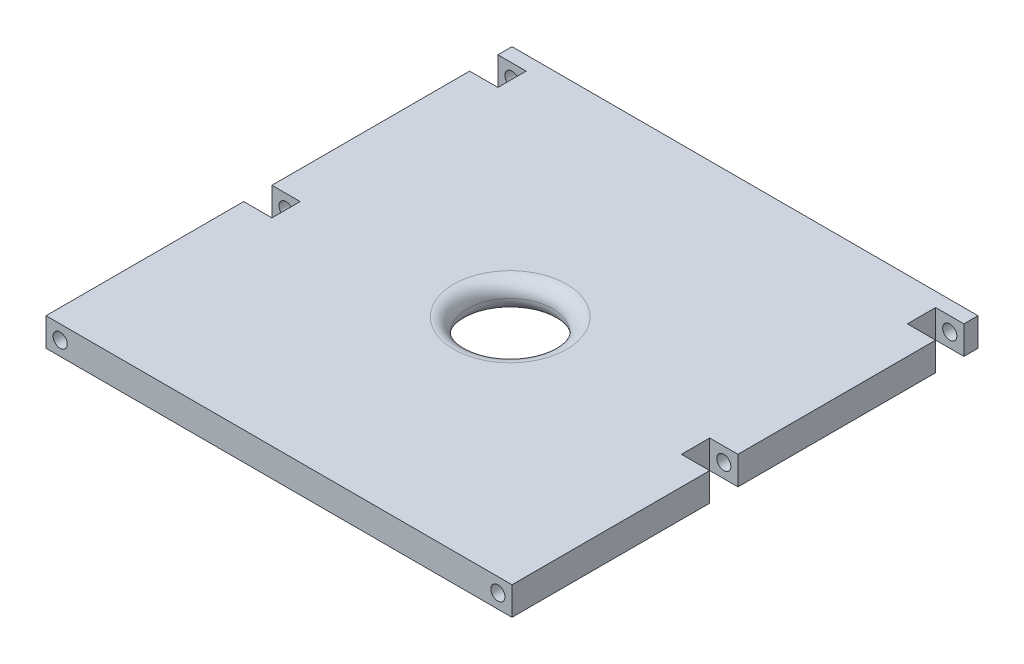
from build123d import *

# Parameters (mm, degrees)
ESQUISSE1_R    = 15
BASE_DEPTH     = 10
ESQUISSE2_R    = 2.5
VIDE_VIS_DEPTH = 185.746447868
CONGE_CABLE_R  = 5


with BuildPart() as part:
    # Esquisse1 → BASE (new body)
    with BuildSketch(Plane(origin=(0, 0, 0), x_dir=(1, 0, 0), z_dir=(0, 1, 0))):
        Polygon((-82.5, 77.5), (-72.5, 77.5), (-72.5, 67.5), (-82.5, 67.5), (-82.5, -2.5), (-72.5, -2.5), (-72.5, -12.5), (-82.5, -12.5), (-82.5, -82.5), (82.5, -82.5), (82.5, -12.5), (72.5, -12.5), (72.5, -2.5), (82.5, -2.5), (82.5, 67.5), (72.5, 67.5), (72.5, 77.5), (82.5, 77.5), (82.5, 82.5), (-82.5, 82.5), align=None)
        with Locations(Location((0, -0.648107225, 0), (0, 0, 270))):
            Circle(ESQUISSE1_R, mode=Mode.SUBTRACT)
    extrude(amount=BASE_DEPTH)

    # Esquisse2 → VIDE VIS (cut, through all)
    with BuildSketch(Plane(origin=(0, 0, -82.5), x_dir=(-1, 0, 0), z_dir=(0, 0, -1))):
        with Locations((-77.5, 5)):
            Circle(ESQUISSE2_R)
        with Locations(Location((77.5, 5, 0), (0, 0, 180))):
            Circle(ESQUISSE2_R)
    extrude(amount=-VIDE_VIS_DEPTH, mode=Mode.SUBTRACT)

    # CONGE CABLE
    conge_cable_edges = [part.edges().sort_by_distance(p)[0] for p in [
        (0, 0, -14.351892775),
        (0, 10, -14.351892775),
    ]]
    fillet(conge_cable_edges, radius=CONGE_CABLE_R - 0.0001)  # a hair under: the kernel refuses the full size


solid = part.part
